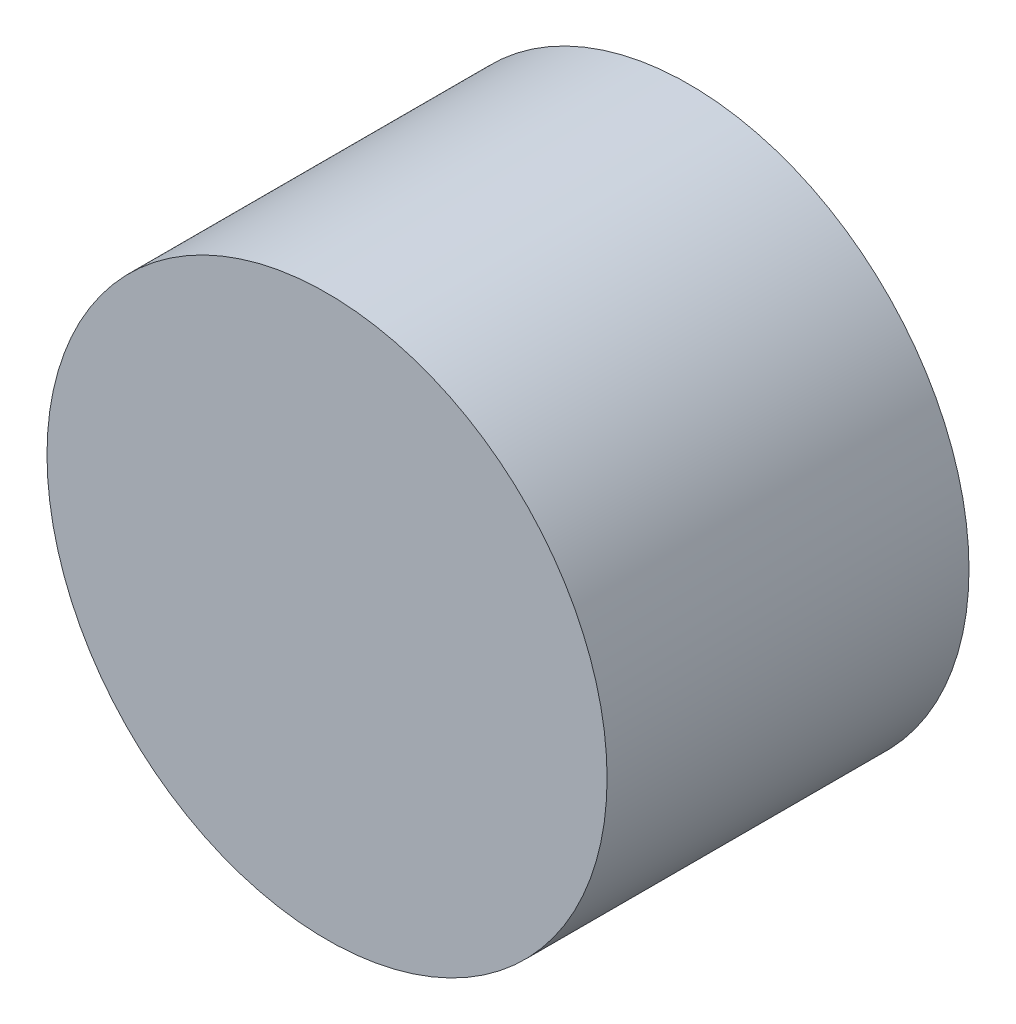
from build123d import *

# Parameters (mm, degrees)
SKETCH1_R           = 32.5
BOSS_EXTRUDE1_DEPTH = 42
BOSS_EXTRUDE5_START = -28
SKETCH2_R           = 32.5
SKETCH2_R_2         = 30
BOSS_EXTRUDE5_DEPTH = 3


with BuildPart() as part:
    # Sketch1 → Boss-Extrude1 (new body)
    with BuildSketch(Plane.XY):
        Circle(SKETCH1_R)
    extrude(amount=BOSS_EXTRUDE1_DEPTH)

    # Sketch2 → Boss-Extrude5 (add)
    with BuildSketch(Plane.XY.offset(42).offset(BOSS_EXTRUDE5_START)):
        Circle(SKETCH2_R)
        Circle(SKETCH2_R_2, mode=Mode.SUBTRACT)
    extrude(amount=BOSS_EXTRUDE5_DEPTH)


solid = part.part
